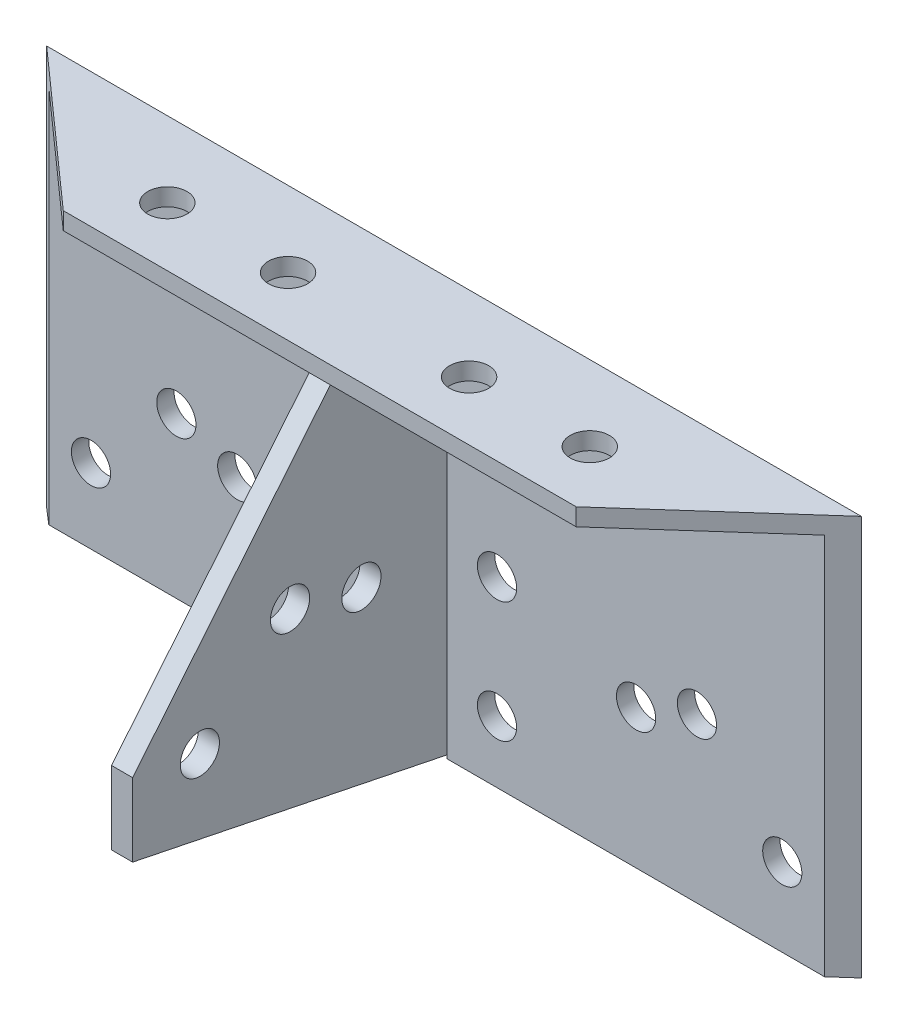
from build123d import *

# Parameters (mm, degrees)
SKETCH_1_W          = 540
SKETCH_1_H          = 265
SKETCH_1_R          = 13
EXTRUDE_549_DEPTH   = 11.5
SKETCH_2_W          = 540
SKETCH_2_H          = 11.5
EXTRUDE_1_DEPTH     = 77.5
CUT_EXTRUDE_1_DEPTH = 609.067430471
SKETCH_4_R          = 13
CUT_EXTRUDE_2_DEPTH = 609.067430471
SKETCH_5_W          = 14
SKETCH_5_H          = 253.5
EXTRUDE_2_DEPTH     = 208.5
SKETCH_6_R          = 13
CUT_EXTRUDE_3_DEPTH = 442.988687638


with BuildPart() as part:
    # 草图1 → Extrude 549 (new body)
    with BuildSketch(Plane.XY):
        with Locations((270, 132.5)):
            Rectangle(SKETCH_1_W, SKETCH_1_H)
        with Locations((97.46594539, 108.46594539)):
            Circle(SKETCH_1_R, mode=Mode.SUBTRACT)
        with Locations((40.897402896, 51.897402896)):
            Circle(SKETCH_1_R, mode=Mode.SUBTRACT)
        with Locations((499.102597104, 51.897402896)):
            Circle(SKETCH_1_R, mode=Mode.SUBTRACT)
        with Locations((402.170987639, 92.261534081)):
            Circle(SKETCH_1_R, mode=Mode.SUBTRACT)
        with Locations((230, 121)):
            Circle(SKETCH_1_R, mode=Mode.SUBTRACT)
        with Locations((230, 41)):
            Circle(SKETCH_1_R, mode=Mode.SUBTRACT)
        with Locations((310, 41)):
            Circle(SKETCH_1_R, mode=Mode.SUBTRACT)
        with Locations((310, 121)):
            Circle(SKETCH_1_R, mode=Mode.SUBTRACT)
        with Locations((137.829012361, 92.261534081)):
            Circle(SKETCH_1_R, mode=Mode.SUBTRACT)
        with Locations((442.53405461, 108.46594539)):
            Circle(SKETCH_1_R, mode=Mode.SUBTRACT)
    extrude(amount=EXTRUDE_549_DEPTH)

    # 草图2 → 凸台-拉伸1 (add)
    with BuildSketch(Plane.XY.offset(11.5)):
        with Locations((270, 259.25)):
            Rectangle(SKETCH_2_W, SKETCH_2_H)
    extrude(amount=EXTRUDE_1_DEPTH)

    # 草图3 → 切除-拉伸1 (cut, through all)
    with BuildSketch(Plane(origin=(0, 265, 0), x_dir=(-1, 0, 0), z_dir=(0, 1, 0))):
        Polygon((0, 0), (-100, 89), (0, 89), align=None)
        Polygon((-540, 0), (-440, 89), (-540, 89), align=None)
    extrude(amount=-CUT_EXTRUDE_1_DEPTH, mode=Mode.SUBTRACT)

    # 草图4 → 切除-拉伸2 (cut, through all)
    with BuildSketch(Plane(origin=(0, 265, 0), x_dir=(-1, 0, 0), z_dir=(0, 1, 0))):
        with Locations((-210, 50)):
            Circle(SKETCH_4_R)
        with Locations((-130, 50)):
            Circle(SKETCH_4_R)
        with Locations((-410, 50)):
            Circle(SKETCH_4_R)
        with Locations((-330, 50)):
            Circle(SKETCH_4_R)
    extrude(amount=-CUT_EXTRUDE_2_DEPTH, mode=Mode.SUBTRACT)

    # 草图5 → 凸台-拉伸2 (add)
    with BuildSketch(Plane.XY.offset(11.5)):
        with Locations((270, 126.75)):
            Rectangle(SKETCH_5_W, SKETCH_5_H)
    extrude(amount=EXTRUDE_2_DEPTH)

    # 草图6 → 切除-拉伸3 (cut, through all)
    with BuildSketch(Plane(origin=(277, 0, 0), x_dir=(0, 0, -1), z_dir=(1, 0, 0))):
        with Locations((-115.676148082, 138.142814541)):
            Circle(SKETCH_6_R)
        with Locations((-175.462621788, 84.986652509)):
            Circle(SKETCH_6_R)
        with Locations((-68.377294113, 126.911974174)):
            Circle(SKETCH_6_R)
        Polygon((-89, 253.5), (-220, 93.5), (-220, 253.5), align=None)
        Polygon((-220, 45), (0, 0), (-220, 0), align=None)
    extrude(amount=-CUT_EXTRUDE_3_DEPTH, mode=Mode.SUBTRACT)


solid = part.part
